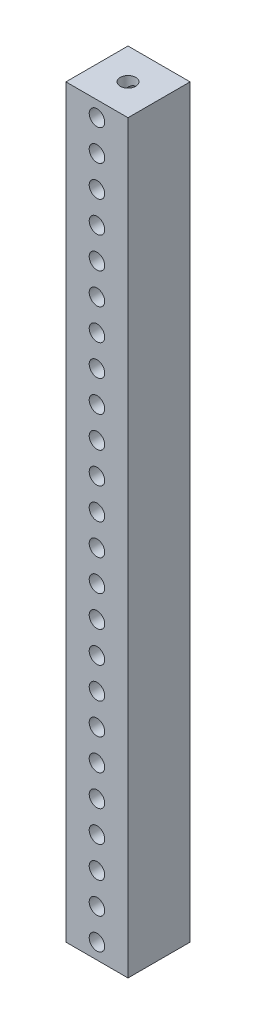
from build123d import *

# Parameters (mm, degrees)
SKETCH2_W           = 20
SKETCH2_H           = 20
SKETCH2_R           = 2.5
BOSS_EXTRUDE1_DEPTH = 240
SKETCH3_R           = 2.5
CUT_EXTRUDE1_DEPTH  = 242.039415864
LPATTERN1_COUNT     = 22
LPATTERN1_PITCH     = 10
SKETCH4_R           = 2.5
CUT_EXTRUDE2_DEPTH  = 242.039415864


with BuildPart() as part:
    # Sketch2 → Boss-Extrude1 (new body)
    with BuildSketch(Plane(origin=(0, 0, 0), x_dir=(1, 0, 0), z_dir=(0, 1, 0))):
        Rectangle(SKETCH2_W, SKETCH2_H)
        Circle(SKETCH2_R, mode=Mode.SUBTRACT)
    extrude(amount=BOSS_EXTRUDE1_DEPTH)

    # Sketch3 → Cut-Extrude1 (cut, through all)
    with BuildSketch(Plane.XY.offset(10)):
        with Locations((0, 5)):
            Circle(SKETCH3_R)
    cut_extrude1 = extrude(amount=-CUT_EXTRUDE1_DEPTH, mode=Mode.SUBTRACT)

    # LPattern1: Cut-Extrude1 ×22
    with Locations(*[(0, i * LPATTERN1_PITCH, 0) for i in range(1, LPATTERN1_COUNT)]):
        add(cut_extrude1, mode=Mode.SUBTRACT)

    # Sketch4 → Cut-Extrude2 (cut, through all)
    with BuildSketch(Plane.XY.offset(10)):
        with Locations((0, 235)):
            Circle(SKETCH4_R)
        with Locations((0, 225)):
            Circle(SKETCH4_R)
    extrude(amount=-CUT_EXTRUDE2_DEPTH, mode=Mode.SUBTRACT)


solid = part.part
